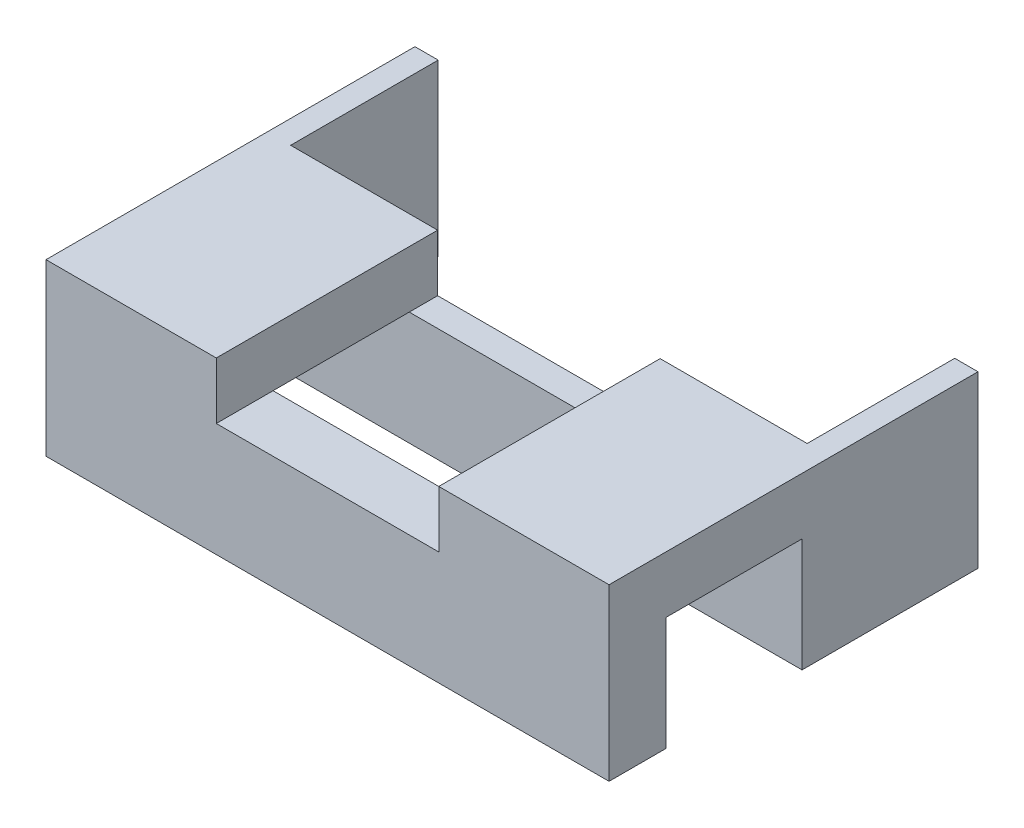
from build123d import *

# Parameters (mm, degrees)
BOSS_EXTRUDE1_DEPTH     = 10
SKETCH2_W               = 17.2
SKETCH2_H               = 43
CUT_EXTRUDE1_DEPTH      = 72.414284285
SKETCH3_W               = 90
SKETCH3_H               = 34
SKETCH3_W_2             = 80
SKETCH3_H_2             = 24
BOSS_EXTRUDE3_DEPTH     = 15
SKETCH4_W               = 49.6
SKETCH4_H               = 5
BOSS_EXTRUDE4_DEPTH     = 10
SKETCH5_W               = 15
SKETCH5_H               = 22
BOSS_EXTRUDE5_DEPTH     = 5
SKETCH6_W               = 90
SKETCH6_H               = 77
BOSS_EXTRUDE6_DEPTH     = 15
BOSS_EXTRUDE8_DEPTH     = 39
CHAMFER1_SIZE           = 64
CHAMFER1_SIZE_2         = 3.354097874
CHAMFER2_SIZE           = 64
CHAMFER2_SIZE_2         = 11.405813635
CHAMFER3_SIZE           = 64
CHAMFER3_SIZE_2         = 13.775745352
CUT_EXTRUDE3_DEPTH      = 95.500525601
CUT_EXTRUDE3_DEPTH_BACK = 95.500525601
SKETCH10_W              = 50
SKETCH10_H              = 27
SKETCH15_R              = 8
CUT_EXTRUDE5_DEPTH      = 122.227059686
CUT_EXTRUDE6_DEPTH      = 2.5
SKETCH18_W              = 29.6
SKETCH18_H              = 43
CUT_EXTRUDE7_DEPTH      = 10
CUT_EXTRUDE8_DEPTH      = 15
SKETCH21_W              = 29.6
SKETCH21_H              = 33
BOSS_EXTRUDE10_DEPTH    = 2.5
SKETCH23_W              = 2.05
SKETCH23_H              = 13
BOSS_EXTRUDE11_DEPTH    = 15
SKETCH24_OUTSIDE_W      = 133.046
SKETCH24_OUTSIDE_H      = 133.046
SKETCH24_OUTSIDE_W_2    = 90
SKETCH24_OUTSIDE_H_2    = 72
CUT_EXTRUDE10_DEPTH     = 61.5
SKETCH26_W              = 100
SKETCH26_H              = 100
CUT_EXTRUDE13_DEPTH     = 10


with BuildPart() as part:
    # Sketch1 → Boss-Extrude1 (new body)
    with BuildSketch(Plane(origin=(0, 0, 0), x_dir=(1, 0, 0), z_dir=(0, 1, 0))):
        with BuildLine():
            Line((-35, 50), (35, 50))
            ThreePointArc((35, 50), (45.606601718, 45.606601718), (50, 35))
            Line((50, 35), (50, -35))
            ThreePointArc((50, -35), (45.606601718, -45.606601718), (35, -50))
            Line((35, -50), (-35, -50))
            ThreePointArc((-35, -50), (-45.606601718, -45.606601718), (-50, -35))
            Line((-50, -35), (-50, 35))
            ThreePointArc((-50, 35), (-45.606601718, 45.606601718), (-35, 50))
        make_face()
    extrude(amount=BOSS_EXTRUDE1_DEPTH)

    # Sketch2 → Cut-Extrude1 (cut, through all)
    with BuildSketch(Plane(origin=(0, 10, 0), x_dir=(1, 0, 0), z_dir=(0, 1, 0))):
        with Locations((-33.4, 18.5)):
            Rectangle(SKETCH2_W, SKETCH2_H)
        with Locations((33.4, 18.5)):
            Rectangle(SKETCH2_W, SKETCH2_H)
    extrude(amount=-CUT_EXTRUDE1_DEPTH, mode=Mode.SUBTRACT)

    # Sketch3 → Boss-Extrude3 (add)
    with BuildSketch(Plane(origin=(0, 10, 0), x_dir=(1, 0, 0), z_dir=(0, 1, 0))):
        with Locations((0, -20)):
            Rectangle(SKETCH3_W, SKETCH3_H)
        with Locations((0, -20)):
            Rectangle(SKETCH3_W_2, SKETCH3_H_2, mode=Mode.SUBTRACT)
    extrude(amount=BOSS_EXTRUDE3_DEPTH)

    # Sketch4 → Boss-Extrude4 (add)
    with BuildSketch(Plane(origin=(0, 10, 0), x_dir=(1, 0, 0), z_dir=(0, 1, 0))):
        with Locations((0, 10)):
            Rectangle(SKETCH4_W, SKETCH4_H)
        with Locations((0, 27)):
            Rectangle(SKETCH4_W, SKETCH4_H)
    extrude(amount=BOSS_EXTRUDE4_DEPTH)

    # Sketch5 → Boss-Extrude5 (add)
    with BuildSketch(Plane(origin=(0, 20, 0), x_dir=(1, 0, 0), z_dir=(0, 1, 0))):
        with Locations((-17.3, 18.5)):
            Rectangle(SKETCH5_W, SKETCH5_H)
        with Locations((17.3, 18.5)):
            Rectangle(SKETCH5_W, SKETCH5_H)
    extrude(amount=BOSS_EXTRUDE5_DEPTH)

    # Sketch6 → Boss-Extrude6 (add)
    with BuildSketch(Plane(origin=(0, 10, 0), x_dir=(1, 0, 0), z_dir=(0, 1, 0))):
        with BuildLine():
            Line((-50, 35), (-50, -35))
            ThreePointArc((-50, -35), (-45.606601718, -45.606601718), (-35, -50))
            Line((-35, -50), (35, -50))
            ThreePointArc((35, -50), (45.606601718, -45.606601718), (50, -35))
            Line((50, -35), (50, 35))
            ThreePointArc((50, 35), (45.606601718, 45.606601718), (35, 50))
            Line((35, 50), (-35, 50))
            ThreePointArc((-35, 50), (-45.606601718, 45.606601718), (-50, 35))
        make_face()
        with Locations((0, 1.5)):
            Rectangle(SKETCH6_W, SKETCH6_H, mode=Mode.SUBTRACT)
    extrude(amount=BOSS_EXTRUDE6_DEPTH)

    # Sketch9 → Boss-Extrude8 (add)
    with BuildSketch(Plane(origin=(0, 25, 0), x_dir=(1, 0, 0), z_dir=(0, 1, 0))):
        with BuildLine():
            Line((-50, 35), (-50, -35))
            ThreePointArc((-50, -35), (-45.606601718, -45.606601718), (-35, -50))
            Line((-35, -50), (35, -50))
            ThreePointArc((35, -50), (45.606601718, -45.606601718), (50, -35))
            Line((50, -35), (50, 35))
            ThreePointArc((50, 35), (45.606601718, 45.606601718), (35, 50))
            Line((35, 50), (-35, 50))
            ThreePointArc((-35, 50), (-45.606601718, 45.606601718), (-50, 35))
        make_face()
        with BuildLine():
            Line((-45, 35), (-45, -32))
            Line((-45, -32), (45, -32))
            Line((45, -32), (45, 35))
            ThreePointArc((45, 35), (44.659258263, 37.588190451), (43.660254038, 40))
            Line((43.660254038, 40), (-43.660254038, 40))
            ThreePointArc((-43.660254038, 40), (-44.659258263, 37.588190451), (-45, 35))
        make_face(mode=Mode.SUBTRACT)
    extrude(amount=BOSS_EXTRUDE8_DEPTH)

    # Chamfer1
    # the kernel refuses this chamfer: 64, 3.354097874 mm, written as the material it takes off along each edge
    with BuildSketch(Plane(origin=(-35, 64, 50), x_dir=(0, -0.9999979738662979, 0.002013023422382214), z_dir=(1, 0, 0)), Plane(origin=(50, 64, 35), x_dir=(0.002013023422382214, -0.9999979738662979, 0), z_dir=(0, 0, -1)), Plane(origin=(-50, 64, -35), x_dir=(-0.002013023422382214, -0.9999979738662979, 0), z_dir=(0, 0, 1)), Plane(origin=(35, 64, -50), x_dir=(0, -0.9999979738662979, -0.002013023422382214), z_dir=(-1, 0, 0))) as chamfer1_piece_1:
        Polygon((CHAMFER1_SIZE * 0.999997973866, CHAMFER1_SIZE * 0.00201302342238), (-CHAMFER1_SIZE_2 * 0.00201302342245, CHAMFER1_SIZE_2 * 0.9999979739), (0, 0), align=None)
    extrude(amount=70, mode=Mode.SUBTRACT)
    with BuildSketch(Plane(origin=(35, 64, 35), x_dir=(0, 0, 1), z_dir=(-1, 0, 0))) as chamfer1_piece_2:
        Polygon((15, -CHAMFER1_SIZE), (15 - CHAMFER1_SIZE_2, 0), (15, 0), align=None)
    revolve(axis=Axis((35, 64, 35), (0, 1, 0)), revolution_arc=90, mode=Mode.SUBTRACT)
    with BuildSketch(Plane(origin=(-35, 64, 35), x_dir=(-1, 0, 0), z_dir=(0, 0, -1))) as chamfer1_piece_3:
        Polygon((15, -CHAMFER1_SIZE), (15 - CHAMFER1_SIZE_2, 0), (15, 0), align=None)
    revolve(axis=Axis((-35, 64, 35), (0, 1, 0)), revolution_arc=90, mode=Mode.SUBTRACT)
    with BuildSketch(Plane(origin=(35, 64, -35), x_dir=(1, 0, 0), z_dir=(0, 0, 1))) as chamfer1_piece_4:
        Polygon((15, -CHAMFER1_SIZE), (15 - CHAMFER1_SIZE_2, 0), (15, 0), align=None)
    revolve(axis=Axis((35, 64, -35), (0, 1, 0)), revolution_arc=90, mode=Mode.SUBTRACT)
    with BuildSketch(Plane(origin=(-35, 64, -35), x_dir=(0, 0, -1), z_dir=(1, 0, 0))) as chamfer1_piece_5:
        Polygon((15 - CHAMFER1_SIZE_2, 0), (15, -CHAMFER1_SIZE), (15, 0), align=None)
    revolve(axis=Axis((-35, 64, -35), (0, 1, 0)), revolution_arc=90, mode=Mode.SUBTRACT)

    # Chamfer2
    # the kernel refuses this chamfer: 64, 11.405813635 mm, written as the material it takes off along each edge
    with BuildSketch(Plane(origin=(201.306482971, 64, -46.645902126), x_dir=(0, -0.9982575003065525, -0.05900816114499234), z_dir=(-1, 0, 0))) as chamfer2_piece_1:
        Polygon((CHAMFER2_SIZE * 0.999977671636, CHAMFER2_SIZE * 0.0066825316561), (-CHAMFER2_SIZE_2 * 0.0590081611462, CHAMFER2_SIZE_2 * 0.998257500326), (0, 0), align=None)
    extrude(amount=402.612965942, mode=Mode.SUBTRACT)

    # Chamfer3
    # the kernel refuses this chamfer: 64, 13.775745352 mm, written as the material it takes off along each edge
    with BuildSketch(Plane(origin=(-201.265469314, 64, 46.645902126), x_dir=(0, -0.9981787050157903, 0.06032638604292662), z_dir=(1, 0, 0))) as chamfer3_piece_1:
        Polygon((CHAMFER3_SIZE * 0.999967974892, CHAMFER3_SIZE * 0.00800307379952), (-CHAMFER3_SIZE_2 * 0.060326386045, CHAMFER3_SIZE_2 * 0.99817870505), (0, 0), align=None)
    extrude(amount=402.530938629, mode=Mode.SUBTRACT)

    # Sketch10 → Cut-Extrude3 (cut, two sides: drawn at the far end of the back side and taken through both)
    with BuildSketch(Plane(origin=(0, 1.307501734, 0), x_dir=(0, 0, 1), z_dir=(-1, 0, 0)).offset(-CUT_EXTRUDE3_DEPTH_BACK)):
        with Locations((-22.129843227, 49.192498266)):
            Rectangle(SKETCH10_W, SKETCH10_H)
    extrude(amount=CUT_EXTRUDE3_DEPTH + CUT_EXTRUDE3_DEPTH_BACK, mode=Mode.SUBTRACT)

    # Sketch15 → Cut-Extrude5 (cut, through all)
    with BuildSketch(Plane.XY.offset(-40)):
        with Locations((-12.75, 20.25)):
            Circle(SKETCH15_R)
        with Locations((12.75, 20.25)):
            Circle(SKETCH15_R)
    extrude(amount=-CUT_EXTRUDE5_DEPTH, mode=Mode.SUBTRACT)

    # Sketch17 → Cut-Extrude6 (cut)
    with BuildSketch(Plane(origin=(0, 0, -29.5), x_dir=(-1, 0, 0), z_dir=(0, 0, -1))):
        Polygon((-24.8, 10), (24.8, 10), (24.8, 25), (9.8, 25), (9.8, 20), (-9.8, 20), (-9.8, 25), (-24.8, 25), align=None)
    extrude(amount=-CUT_EXTRUDE6_DEPTH, mode=Mode.SUBTRACT)

    # Sketch18 → Cut-Extrude7 (cut)
    with BuildSketch(Plane.XZ):
        with Locations((0, -18.5)):
            Rectangle(SKETCH18_W, SKETCH18_H)
    extrude(amount=-CUT_EXTRUDE7_DEPTH, mode=Mode.SUBTRACT)

    # Sketch20 → Cut-Extrude8 (cut)
    with BuildSketch(Plane.XZ.offset(-25)):
        with BuildLine():
            Line((-45, -35), (-45, -40))
            Line((-45, -40), (-43.660254038, -40))
            ThreePointArc((-43.660254038, -40), (-44.659258263, -37.588190451), (-45, -35))
        make_face()
        with BuildLine():
            Line((45, -40), (45, -35))
            ThreePointArc((45, -35), (44.659258263, -37.588190451), (43.660254038, -40))
            Line((43.660254038, -40), (45, -40))
        make_face()
    extrude(amount=-CUT_EXTRUDE8_DEPTH, mode=Mode.SUBTRACT)

    # Sketch21 → Boss-Extrude10 (add)
    with BuildSketch(Plane.XZ):
        with Locations((0, -13.5)):
            Rectangle(SKETCH21_W, SKETCH21_H)
    extrude(amount=-BOSS_EXTRUDE10_DEPTH)

    # Sketch23 → Boss-Extrude11 (add)
    with BuildSketch(Plane(origin=(0, 10, 0), x_dir=(1, 0, 0), z_dir=(0, 1, 0))):
        with Locations((-23.775, 33.5)):
            Rectangle(SKETCH23_W, SKETCH23_H)
        with Locations((23.775, 33.5)):
            Rectangle(SKETCH23_W, SKETCH23_H)
    extrude(amount=BOSS_EXTRUDE11_DEPTH)

    # Sketch24 outside → Cut-Extrude10 (cut)
    with BuildSketch(Plane(origin=(0, 64, 0), x_dir=(1, 0, 0), z_dir=(0, 1, 0))):
        Rectangle(SKETCH24_OUTSIDE_W, SKETCH24_OUTSIDE_H)
        with Locations((0, 4)):
            Rectangle(SKETCH24_OUTSIDE_W_2, SKETCH24_OUTSIDE_H_2, mode=Mode.SUBTRACT)
    extrude(amount=-CUT_EXTRUDE10_DEPTH, mode=Mode.SUBTRACT)

    # Sketch26 → Cut-Extrude13 (cut)
    with BuildSketch(Plane.XZ):
        Rectangle(SKETCH26_W, SKETCH26_H)
    extrude(amount=-CUT_EXTRUDE13_DEPTH, mode=Mode.SUBTRACT)


with BuildPart() as body_2:
    # of the pieces the cut leaves, the one that is kept (cut_extrude13_keep)
    add(part.part.solids().sort_by_distance((24.8, 25, -7.5))[0])


solid = body_2.part
